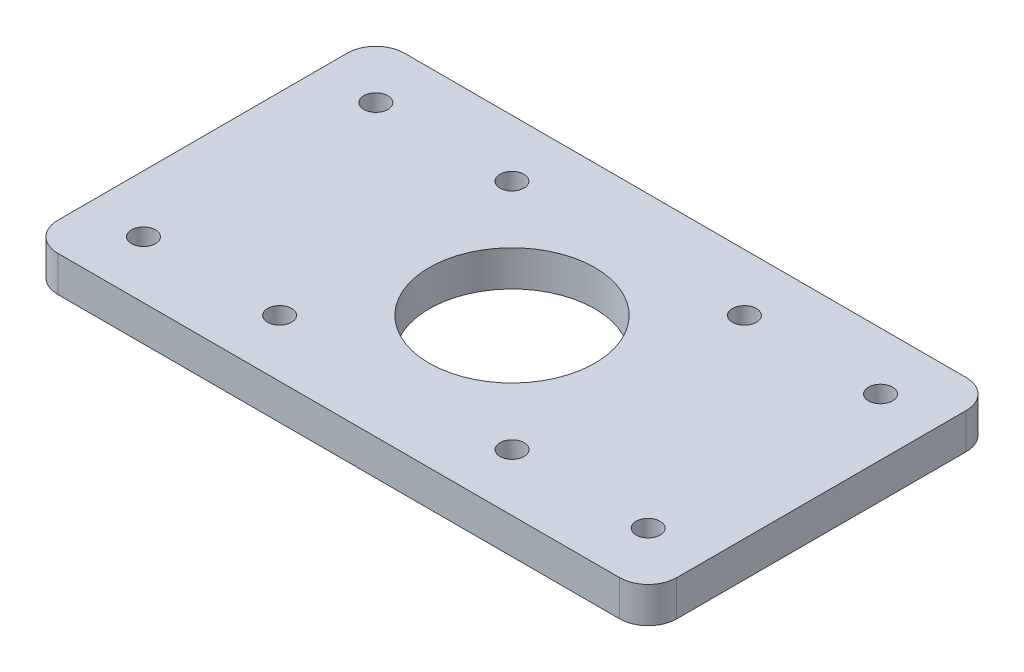
from build123d import *

# Parameters (mm, degrees)
SKETCH1_W           = 82.55
SKETCH1_H           = 46.228
SKETCH1_R           = 1.5999968
SKETCH1_R_2         = 11.049
BOSS_EXTRUDE1_DEPTH = 4.7625
FILLET1_R           = 3.81


with BuildPart() as part:
    # Sketch1 → Boss-Extrude1 (new body)
    with BuildSketch(Plane(origin=(0, 0, 0), x_dir=(1, 0, 0), z_dir=(0, 1, 0))):
        with Locations((41.275, 23.114)):
            Rectangle(SKETCH1_W, SKETCH1_H)
        with Locations((74.93, 38.608)):
            Circle(SKETCH1_R, mode=Mode.SUBTRACT)
        with Locations((7.62, 38.608)):
            Circle(SKETCH1_R, mode=Mode.SUBTRACT)
        with Locations((74.93, 7.62)):
            Circle(SKETCH1_R, mode=Mode.SUBTRACT)
        with Locations((7.62, 7.62)):
            Circle(SKETCH1_R, mode=Mode.SUBTRACT)
        with Locations((41.275, 23.114)):
            Circle(SKETCH1_R_2, mode=Mode.SUBTRACT)
        with Locations((25.775, 38.608)):
            Circle(SKETCH1_R, mode=Mode.SUBTRACT)
        with Locations((56.775, 38.608)):
            Circle(SKETCH1_R, mode=Mode.SUBTRACT)
        with Locations((25.775, 7.62)):
            Circle(SKETCH1_R, mode=Mode.SUBTRACT)
        with Locations((56.775, 7.62)):
            Circle(SKETCH1_R, mode=Mode.SUBTRACT)
    extrude(amount=BOSS_EXTRUDE1_DEPTH)

    # Fillet1
    fillet1_edges = [part.edges().sort_by_distance(p)[0] for p in [
        (82.55, 2.38125, -46.228),
        (82.55, 2.38125, 0),
        (0, 2.38125, 0),
        (0, 2.38125, -46.228),
    ]]
    fillet(fillet1_edges, radius=FILLET1_R)


solid = part.part
